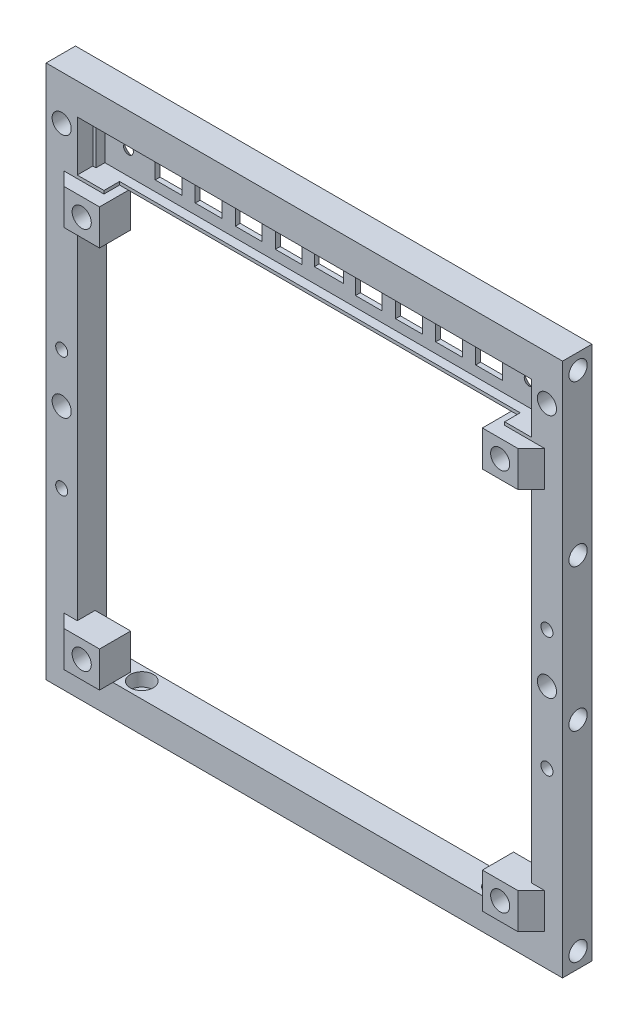
from build123d import *
from build123d.topology import SkipClean

# Parameters (mm, degrees)
SKETCH1_W                = 116
SKETCH1_H                = 120
SKETCH1_W_2              = 102
SKETCH1_H_2              = 106
BOSS_EXTRUDE1_DEPTH      = 7
SKETCH2_R                = 2.05
CUT_EXTRUDE1_DEPTH       = 6
SKETCH3_R                = 1.35
CUT_EXTRUDE2_DEPTH       = 128.208490283
SKETCH4_R                = 2.6
CUT_EXTRUDE3_DEPTH       = 3
SKETCH5_R                = 1.35
CUT_EXTRUDE4_DEPTH       = 84.743656476
SKETCH6_R                = 2.5
CUT_EXTRUDE5_DEPTH       = 3
SKETCH7_R                = 2.15
CUT_EXTRUDE6_DEPTH       = 84.743656476
CUT_EXTRUDE7_DEPTH       = 0.2
SKETCH9_W                = 2.7
SKETCH9_H                = 2.7
CUT_EXTRUDE8_DEPTH       = 0.2
SKETCH10_W               = 6
SKETCH10_H               = 6
BOSS_EXTRUDE2_DEPTH      = 5.5
SKETCH11_R               = 1.65
CUT_EXTRUDE9_DEPTH       = 84.631632771
SKETCH12_W               = 102
SKETCH12_H               = 12
BOSS_EXTRUDE3_DEPTH      = 1.5
SKETCH13_W               = 102
SKETCH13_H               = 12
SKETCH13_W_2             = 100.6
SKETCH13_H_2             = 10.6
BOSS_EXTRUDE4_DEPTH      = 2
SKETCH14_W               = 6
SKETCH14_H               = 6
SKETCH14_W_2             = 6.5
SKETCH14_H_2             = 4
CUT_EXTRUDE10_DEPTH      = 84.631632771
SKETCH15_R               = 1
BOSS_EXTRUDE5_DEPTH      = 2
CHAMFER1_SIZE            = 0.4
CHAMFER2_SIZE            = 0.4
CHAMFER3_SIZE            = 0.4
SKETCH16_W               = 6
SKETCH16_H               = 6
BOSS_EXTRUDE7_DEPTH      = 5.5
SKETCH17_R               = 1.65
CUT_EXTRUDE11_DEPTH      = 84.631632771
CUT_EXTRUDE12_DEPTH      = 84.631632771
CUT_EXTRUDE12_DEPTH_BACK = 84.631632771
SKETCH18_R               = 1.1
CHAMFER4_SIZE            = 1.5
SKETCH19_W               = 102
SKETCH19_H               = 94
CUT_EXTRUDE13_DEPTH      = 84.631632771
SKETCH20_W               = 8
SKETCH20_H               = 8
BOSS_EXTRUDE8_DEPTH      = 7
CHAMFER5_SIZE            = 3
SKETCH21_R               = 2.15
CUT_EXTRUDE14_DEPTH      = 84.743656476
CHAMFER6_SIZE            = 0.4
CHAMFER7_SIZE            = 0.4


# Some blends are built 0.0001 mm under size
with BuildPart() as part:
    # Sketch1 → Boss-Extrude1 (new body)
    with BuildSketch(Plane.XY):
        Rectangle(SKETCH1_W, SKETCH1_H)
        Rectangle(SKETCH1_W_2, SKETCH1_H_2, mode=Mode.SUBTRACT)
    extrude(amount=BOSS_EXTRUDE1_DEPTH)

    # Sketch2 → Cut-Extrude1 (cut)
    with BuildSketch(Plane.ZY.offset(58)):
        with Locations((3.5, -56.5)):
            Circle(SKETCH2_R)
        with Locations((3.5, 56.5)):
            Circle(SKETCH2_R)
        with Locations((3.5, 20.5)):
            Circle(SKETCH2_R)
        with Locations((3.5, -11.5)):
            Circle(SKETCH2_R)
    cut_extrude1 = extrude(amount=-CUT_EXTRUDE1_DEPTH, mode=Mode.SUBTRACT)

    # Mirror1: Cut-Extrude1 across plane
    add(cut_extrude1.mirror(Plane(origin=(0, 0, 0), x_dir=(0, 0, 1), z_dir=(1, 0, 0))), mode=Mode.SUBTRACT)

    # Sketch3 → Cut-Extrude2 (cut, through all)
    with BuildSketch(Plane(origin=(0, -53, 0), x_dir=(1, 0, 0), z_dir=(0, 1, 0))):
        with Locations(Location((40, -3.5, 0), (0, 0, 270))):
            Circle(SKETCH3_R)
        with Locations(Location((-40, -3.5, 0), (0, 0, 270))):
            Circle(SKETCH3_R)
    extrude(amount=-CUT_EXTRUDE2_DEPTH, mode=Mode.SUBTRACT)

    # Sketch4 → Cut-Extrude3 (cut)
    with BuildSketch(Plane(origin=(0, -53, 0), x_dir=(1, 0, 0), z_dir=(0, 1, 0))):
        with Locations(Location((40, -3.5, 0), (0, 0, 270))):
            Circle(SKETCH4_R)
        with Locations(Location((-40, -3.5, 0), (0, 0, 270))):
            Circle(SKETCH4_R)
    extrude(amount=-CUT_EXTRUDE3_DEPTH, mode=Mode.SUBTRACT)

    # Sketch5 → Cut-Extrude4 (cut, through all)
    with BuildSketch(Plane(origin=(0, 0, 0), x_dir=(-1, 0, 0), z_dir=(0, 0, -1))):
        with Locations((-54.5, 6)):
            Circle(SKETCH5_R)
        with Locations(Location((54.5, 6, 0), (0, 0, 180))):
            Circle(SKETCH5_R)
        with Locations((-54.5, -21)):
            Circle(SKETCH5_R)
        with Locations(Location((54.5, -21, 0), (0, 0, 180))):
            Circle(SKETCH5_R)
    extrude(amount=-CUT_EXTRUDE4_DEPTH, mode=Mode.SUBTRACT)

    # Sketch6 → Cut-Extrude5 (cut)
    with BuildSketch(Plane(origin=(0, 0, 0), x_dir=(-1, 0, 0), z_dir=(0, 0, -1))):
        with Locations((-54.5, 6)):
            Circle(SKETCH6_R)
        with Locations((54.5, 6)):
            Circle(SKETCH6_R)
        with Locations((-54.5, -21)):
            Circle(SKETCH6_R)
        with Locations((54.5, -21)):
            Circle(SKETCH6_R)
    extrude(amount=-CUT_EXTRUDE5_DEPTH, mode=Mode.SUBTRACT)

    # Sketch7 → Cut-Extrude6 (cut, through all)
    with BuildSketch(Plane(origin=(0, 0, 0), x_dir=(-1, 0, 0), z_dir=(0, 0, -1))):
        with Locations((-54.5, 50)):
            Circle(SKETCH7_R)
        with Locations((-54.5, -5)):
            Circle(SKETCH7_R)
    cut_extrude6 = extrude(amount=-CUT_EXTRUDE6_DEPTH, mode=Mode.SUBTRACT)

    # Mirror2: Cut-Extrude6 across plane
    add(cut_extrude6.mirror(Plane(origin=(0, 0, 0), x_dir=(0, 0, 1), z_dir=(1, 0, 0))), mode=Mode.SUBTRACT)

    # Sketch8 → Cut-Extrude7 (cut)
    with SkipClean():  # the faces are left unmerged after this step: merging them gives an invalid solid
        with BuildSketch(Plane(origin=(0, 0, 3), x_dir=(-1, 0, 0), z_dir=(0, 0, -1))):
            with BuildLine():
                Line((-55.85, 3.895837459), (-55.85, 8.104162541))
                ThreePointArc((-55.85, 8.104162541), (-54.5, 8.5), (-53.15, 8.104162541))
                Line((-53.15, 8.104162541), (-53.15, 3.895837459))
                ThreePointArc((-53.15, 3.895837459), (-54.5, 3.5), (-55.85, 3.895837459))
            make_face()
            with BuildLine():
                Line((-55.85, -23.104162541), (-55.85, -18.895837459))
                ThreePointArc((-55.85, -18.895837459), (-54.5, -18.5), (-53.15, -18.895837459))
                Line((-53.15, -18.895837459), (-53.15, -23.104162541))
                ThreePointArc((-53.15, -23.104162541), (-54.5, -23.5), (-55.85, -23.104162541))
            make_face()
        cut_extrude7 = extrude(amount=-CUT_EXTRUDE7_DEPTH, mode=Mode.SUBTRACT)

    # Sketch9 → Cut-Extrude8 (cut)
    with SkipClean():  # the faces are left unmerged after this step: merging them gives an invalid solid
        with BuildSketch(Plane(origin=(0, 0, 3.2), x_dir=(-1, 0, 0), z_dir=(0, 0, -1))):
            with Locations((-54.5, 6)):
                Rectangle(SKETCH9_W, SKETCH9_H)
            with Locations((-54.5, -21)):
                Rectangle(SKETCH9_W, SKETCH9_H)
        cut_extrude8 = extrude(amount=-CUT_EXTRUDE8_DEPTH, mode=Mode.SUBTRACT)

    # Mirror3: Cut-Extrude7, Cut-Extrude8 across plane
    with SkipClean():  # the faces are left unmerged after this step: merging them gives an invalid solid
        add(cut_extrude7.mirror(Plane(origin=(0, 0, 0), x_dir=(0, 0, 1), z_dir=(1, 0, 0))), mode=Mode.SUBTRACT)
        add(cut_extrude8.mirror(Plane(origin=(0, 0, 0), x_dir=(0, 0, 1), z_dir=(1, 0, 0))), mode=Mode.SUBTRACT)

    # Sketch10 → Boss-Extrude2 (add)
    with SkipClean():  # the faces are left unmerged after this step: merging them gives an invalid solid
        with BuildSketch(Plane.XY.offset(7)):
            with Locations((48, -50)):
                Rectangle(SKETCH10_W, SKETCH10_H)
            with Locations((48, -20.5)):
                Rectangle(SKETCH10_W, SKETCH10_H)
        boss_extrude2 = extrude(amount=-BOSS_EXTRUDE2_DEPTH)

    # Sketch11 → Cut-Extrude9 (cut, through all)
    with SkipClean():  # the faces are left unmerged after this step: merging them gives an invalid solid
        with BuildSketch(Plane(origin=(0, 0, 1.5), x_dir=(-1, 0, 0), z_dir=(0, 0, -1))):
            with Locations((-48, -20.5)):
                Circle(SKETCH11_R)
            with Locations((-48, -50)):
                Circle(SKETCH11_R)
        cut_extrude9 = extrude(amount=-CUT_EXTRUDE9_DEPTH, mode=Mode.SUBTRACT)

    # Mirror4: Boss-Extrude2, Cut-Extrude9 across plane
    with SkipClean():  # the faces are left unmerged after this step: merging them gives an invalid solid
        add(boss_extrude2.mirror(Plane(origin=(0, 0, 0), x_dir=(0, 0, 1), z_dir=(1, 0, 0))))
        add(cut_extrude9.mirror(Plane(origin=(0, 0, 0), x_dir=(0, 0, 1), z_dir=(1, 0, 0))), mode=Mode.SUBTRACT)

    # Sketch12 → Boss-Extrude3 (add)
    with SkipClean():  # the faces are left unmerged after this step: merging them gives an invalid solid
        with BuildSketch(Plane(origin=(0, 0, 0), x_dir=(-1, 0, 0), z_dir=(0, 0, -1))):
            with Locations((0, 47)):
                Rectangle(SKETCH12_W, SKETCH12_H)
        extrude(amount=-BOSS_EXTRUDE3_DEPTH)

    # Sketch13 → Boss-Extrude4 (add)
    with SkipClean():  # the faces are left unmerged after this step: merging them gives an invalid solid
        with BuildSketch(Plane.XY.offset(1.5)):
            with Locations((0, 47)):
                Rectangle(SKETCH13_W, SKETCH13_H)
            with Locations((0, 47)):
                Rectangle(SKETCH13_W_2, SKETCH13_H_2, mode=Mode.SUBTRACT)
        extrude(amount=BOSS_EXTRUDE4_DEPTH)

    # Sketch14 → Cut-Extrude10 (cut, through all)
    with SkipClean():  # the faces are left unmerged after this step: merging them gives an invalid solid
        with BuildSketch(Plane.XY.offset(1.5)):
            with Locations((-36, 47)):
                Rectangle(SKETCH14_W, SKETCH14_H)
            with Locations((0, 47)):
                Rectangle(SKETCH14_W_2, SKETCH14_H_2)
            with Locations((9, 47)):
                Rectangle(SKETCH14_W, SKETCH14_H)
            with Locations((18, 47)):
                Rectangle(SKETCH14_W, SKETCH14_H)
            with Locations((27, 47)):
                Rectangle(SKETCH14_W, SKETCH14_H)
            with Locations((36, 47)):
                Rectangle(SKETCH14_W, SKETCH14_H)
            with Locations((-27, 47)):
                Rectangle(SKETCH14_W, SKETCH14_H)
            with Locations((-18, 47)):
                Rectangle(SKETCH14_W, SKETCH14_H)
            with Locations((-9, 47)):
                Rectangle(SKETCH14_W, SKETCH14_H)
        extrude(amount=-CUT_EXTRUDE10_DEPTH, mode=Mode.SUBTRACT)

    # Sketch15 → Boss-Extrude5 (add)
    with SkipClean():  # the faces are left unmerged after this step: merging them gives an invalid solid
        with BuildSketch(Plane.XY.offset(1.5)):
            with Locations(Location((-45, 47, 0), (0, 0, 180))):
                Circle(SKETCH15_R)
            with Locations(Location((45, 47, 0), (0, 0, 180))):
                Circle(SKETCH15_R)
        extrude(amount=BOSS_EXTRUDE5_DEPTH)

    # Chamfer1
    # the kernel refuses this chamfer: 0.4 mm, written as the material it takes off along each edge
    with BuildSketch(Plane(origin=(51, -53, 0), x_dir=(0.9996219169112968, 0, -0.02749587661058673), z_dir=(0, 1, 0)), Plane(origin=(-51, 41, 0), x_dir=(-0.9996219169112968, 0, -0.02749587661058673), z_dir=(0, -1, 0))) as chamfer1_piece_1:
        Polygon((CHAMFER1_SIZE * 0.999621916911, -CHAMFER1_SIZE * 0.0274958766106), (-CHAMFER1_SIZE * 0.0274958766106, -CHAMFER1_SIZE * 0.999621916911), (0, 0), align=None)
    extrude(amount=94, mode=Mode.SUBTRACT)
    with BuildSketch(Plane(origin=(-51, -53, 0), x_dir=(0, -0.9996219169112968, -0.02749587661058673), z_dir=(1, 0, 0))) as chamfer1_piece_2:
        Polygon((CHAMFER1_SIZE * 0.999621916911, -CHAMFER1_SIZE * 0.0274958766106), (-CHAMFER1_SIZE * 0.0274958766106, -CHAMFER1_SIZE * 0.999621916911), (0, 0), align=None)
    extrude(amount=102, mode=Mode.SUBTRACT)
    with BuildSketch(Plane(origin=(-51, 41, 0), x_dir=(0, 0.9996219169112968, -0.02749587661058673), z_dir=(1, 0, 0))) as chamfer1_piece_3:
        Polygon((CHAMFER1_SIZE * 0.999621916911, CHAMFER1_SIZE * 0.0274958766106), (-CHAMFER1_SIZE * 0.0274958766106, CHAMFER1_SIZE * 0.999621916911), (0, 0), align=None)
    extrude(amount=102, mode=Mode.SUBTRACT)
    with BuildSketch(Plane(origin=(-51, -53, 0), x_dir=(0, -0.9996219169112968, -0.02749587661058673), z_dir=(1, 0, 0))) as chamfer1_piece_4a_section:
        Polygon((CHAMFER1_SIZE * 0.999621916911, -CHAMFER1_SIZE * 0.0274958766106), (-CHAMFER1_SIZE * 0.0274958766106, -CHAMFER1_SIZE * 0.999621916911), (0, 0), align=None)
    chamfer1_piece_4a = extrude(amount=103.028673195, mode=Mode.PRIVATE)
    chamfer1_piece_4a = split(chamfer1_piece_4a, bisect_by=Plane(origin=(51, -53.131917451, 0.131917451), z_dir=(1, 0, 0)), keep=Keep.TOP, mode=Mode.PRIVATE)
    with BuildSketch(Plane(origin=(51, -54.028673195, 0), x_dir=(0.9996219169112968, 0, -0.02749587661058673), z_dir=(0, 1, 0))) as chamfer1_piece_4b_section:
        Polygon((CHAMFER1_SIZE * 0.999621916911, -CHAMFER1_SIZE * 0.0274958766106), (-CHAMFER1_SIZE * 0.0274958766106, -CHAMFER1_SIZE * 0.999621916911), (0, 0), align=None)
    chamfer1_piece_4b = extrude(amount=95.028673195, mode=Mode.PRIVATE)
    chamfer1_piece_4b = split(chamfer1_piece_4b, bisect_by=Plane(origin=(51.131917451, -53, 0.131917451), z_dir=(0, -1, 0)), keep=Keep.TOP, mode=Mode.PRIVATE)
    chamfer1_piece_4 = chamfer1_piece_4a & chamfer1_piece_4b
    add(chamfer1_piece_4, mode=Mode.SUBTRACT)
    with BuildSketch(Plane(origin=(51, -53, 0), x_dir=(0.9996219169112968, 0, -0.02749587661058673), z_dir=(0, 1, 0))) as chamfer1_piece_5a_section:
        Polygon((CHAMFER1_SIZE * 0.999621916911, -CHAMFER1_SIZE * 0.0274958766106), (-CHAMFER1_SIZE * 0.0274958766106, -CHAMFER1_SIZE * 0.999621916911), (0, 0), align=None)
    chamfer1_piece_5a = extrude(amount=95.028673195, mode=Mode.PRIVATE)
    chamfer1_piece_5a = split(chamfer1_piece_5a, bisect_by=Plane(origin=(51.131917451, 41, 0.131917451), z_dir=(0, 1, 0)), keep=Keep.TOP, mode=Mode.PRIVATE)
    with BuildSketch(Plane(origin=(-51, 41, 0), x_dir=(0, 0.9996219169112968, -0.02749587661058673), z_dir=(1, 0, 0))) as chamfer1_piece_5b_section:
        Polygon((CHAMFER1_SIZE * 0.999621916911, CHAMFER1_SIZE * 0.0274958766106), (-CHAMFER1_SIZE * 0.0274958766106, CHAMFER1_SIZE * 0.999621916911), (0, 0), align=None)
    chamfer1_piece_5b = extrude(amount=103.028673195, mode=Mode.PRIVATE)
    chamfer1_piece_5b = split(chamfer1_piece_5b, bisect_by=Plane(origin=(51, 41.131917451, 0.131917451), z_dir=(1, 0, 0)), keep=Keep.TOP, mode=Mode.PRIVATE)
    chamfer1_piece_5 = chamfer1_piece_5a & chamfer1_piece_5b
    add(chamfer1_piece_5, mode=Mode.SUBTRACT)
    with BuildSketch(Plane(origin=(-51, 41, 0), x_dir=(-0.9996219169112968, 0, -0.02749587661058673), z_dir=(0, -1, 0))) as chamfer1_piece_6a_section:
        Polygon((CHAMFER1_SIZE * 0.999621916911, -CHAMFER1_SIZE * 0.0274958766106), (-CHAMFER1_SIZE * 0.0274958766106, -CHAMFER1_SIZE * 0.999621916911), (0, 0), align=None)
    chamfer1_piece_6a = extrude(amount=95.028673195, mode=Mode.PRIVATE)
    chamfer1_piece_6a = split(chamfer1_piece_6a, bisect_by=Plane(origin=(-51.131917451, -53, 0.131917451), z_dir=(0, -1, 0)), keep=Keep.TOP, mode=Mode.PRIVATE)
    with BuildSketch(Plane(origin=(-52.028673195, -53, 0), x_dir=(0, -0.9996219169112968, -0.02749587661058673), z_dir=(1, 0, 0))) as chamfer1_piece_6b_section:
        Polygon((CHAMFER1_SIZE * 0.999621916911, -CHAMFER1_SIZE * 0.0274958766106), (-CHAMFER1_SIZE * 0.0274958766106, -CHAMFER1_SIZE * 0.999621916911), (0, 0), align=None)
    chamfer1_piece_6b = extrude(amount=103.028673195, mode=Mode.PRIVATE)
    chamfer1_piece_6b = split(chamfer1_piece_6b, bisect_by=Plane(origin=(-51, -53.131917451, 0.131917451), z_dir=(-1, 0, 0)), keep=Keep.TOP, mode=Mode.PRIVATE)
    chamfer1_piece_6 = chamfer1_piece_6a & chamfer1_piece_6b
    add(chamfer1_piece_6, mode=Mode.SUBTRACT)
    with BuildSketch(Plane(origin=(-51, 42.028673195, 0), x_dir=(-0.9996219169112968, 0, -0.02749587661058673), z_dir=(0, -1, 0))) as chamfer1_piece_7a_section:
        Polygon((CHAMFER1_SIZE * 0.999621916911, -CHAMFER1_SIZE * 0.0274958766106), (-CHAMFER1_SIZE * 0.0274958766106, -CHAMFER1_SIZE * 0.999621916911), (0, 0), align=None)
    chamfer1_piece_7a = extrude(amount=95.028673195, mode=Mode.PRIVATE)
    chamfer1_piece_7a = split(chamfer1_piece_7a, bisect_by=Plane(origin=(-51.131917451, 41, 0.131917451), z_dir=(0, 1, 0)), keep=Keep.TOP, mode=Mode.PRIVATE)
    with BuildSketch(Plane(origin=(-52.028673195, 41, 0), x_dir=(0, 0.9996219169112968, -0.02749587661058673), z_dir=(1, 0, 0))) as chamfer1_piece_7b_section:
        Polygon((CHAMFER1_SIZE * 0.999621916911, CHAMFER1_SIZE * 0.0274958766106), (-CHAMFER1_SIZE * 0.0274958766106, CHAMFER1_SIZE * 0.999621916911), (0, 0), align=None)
    chamfer1_piece_7b = extrude(amount=103.028673195, mode=Mode.PRIVATE)
    chamfer1_piece_7b = split(chamfer1_piece_7b, bisect_by=Plane(origin=(-51, 41.131917451, 0.131917451), z_dir=(-1, 0, 0)), keep=Keep.TOP, mode=Mode.PRIVATE)
    chamfer1_piece_7 = chamfer1_piece_7a & chamfer1_piece_7b
    add(chamfer1_piece_7, mode=Mode.SUBTRACT)

    # Chamfer2
    chamfer2_edges = [part.edges().sort_by_distance(p)[0] for p in [
        (0, -60, 0),
        (-58, 0, 0),
        (0, 60, 0),
        (58, 0, 0),
    ]]
    chamfer(chamfer2_edges, length=CHAMFER2_SIZE)

    # Chamfer3
    chamfer3_edges = [part.edges().sort_by_distance(p)[0] for p in [
        (-6, 47, 0),
        (-9, 44, 0),
        (-12, 47, 0),
        (-9, 50, 0),
        (-15, 47, 0),
        (-18, 44, 0),
        (-21, 47, 0),
        (-18, 50, 0),
        (-24, 47, 0),
        (-27, 44, 0),
        (-30, 47, 0),
        (-27, 50, 0),
        (-33, 47, 0),
        (-36, 44, 0),
        (-39, 47, 0),
        (-36, 50, 0),
        (39, 47, 0),
        (36, 44, 0),
        (33, 47, 0),
        (36, 50, 0),
        (30, 47, 0),
        (27, 44, 0),
        (24, 47, 0),
        (27, 50, 0),
        (21, 47, 0),
        (18, 44, 0),
        (15, 47, 0),
        (18, 50, 0),
        (12, 47, 0),
        (9, 44, 0),
        (6, 47, 0),
        (9, 50, 0),
        (3.25, 47, 0),
        (0, 45, 0),
        (-3.25, 47, 0),
        (0, 49, 0),
    ]]
    chamfer(chamfer3_edges, length=CHAMFER3_SIZE)

    # Sketch16 → Boss-Extrude7 (add)
    with BuildSketch(Plane.XY.offset(7)):
        Polygon((-45, 41), (-45, 41.7), (-51, 41.7), (-51, 41), (-51, 35), (-45, 35), align=None)
        with Locations((-48, -14.5)):
            Rectangle(SKETCH16_W, SKETCH16_H)
        with Locations((48, -14.5)):
            Rectangle(SKETCH16_W, SKETCH16_H)
        Polygon((51, 41), (51, 35), (45, 35), (45, 41), (45, 41.7), (51, 41.7), align=None)
    extrude(amount=-BOSS_EXTRUDE7_DEPTH)

    # Sketch17 → Cut-Extrude11 (cut, through all)
    with BuildSketch(Plane(origin=(0, 0, 1.5), x_dir=(-1, 0, 0), z_dir=(0, 0, -1))):
        with Locations((-48, -14.5)):
            Circle(SKETCH17_R)
        with Locations((48, -14.5)):
            Circle(SKETCH17_R)
        with Locations((48, 38)):
            Circle(SKETCH17_R)
        with Locations((-48, 38)):
            Circle(SKETCH17_R)
    extrude(amount=-CUT_EXTRUDE11_DEPTH, mode=Mode.SUBTRACT)

    # Sketch18 → Cut-Extrude12 (cut, two sides: drawn at the far end of the back side and taken through both)
    with BuildSketch(Plane.XY.offset(1.5).offset(-CUT_EXTRUDE12_DEPTH_BACK)):
        with Locations((-45, 47)):
            Circle(SKETCH18_R)
        with Locations((45, 47)):
            Circle(SKETCH18_R)
    extrude(amount=CUT_EXTRUDE12_DEPTH + CUT_EXTRUDE12_DEPTH_BACK, mode=Mode.SUBTRACT)

    # Chamfer4
    chamfer4_edges = [part.edges().sort_by_distance(p)[0] for p in [
        (-46.1, 47, 0),
        (43.9, 47, 0),
    ]]
    chamfer(chamfer4_edges, length=CHAMFER4_SIZE - 0.0001)  # a hair under: the kernel refuses the full size

    # Sketch19 → Cut-Extrude13 (cut, through all)
    with BuildSketch(Plane(origin=(0, 0, 1.5), x_dir=(-1, 0, 0), z_dir=(0, 0, -1))):
        with Locations((0, -6)):
            Rectangle(SKETCH19_W, SKETCH19_H)
    extrude(amount=-CUT_EXTRUDE13_DEPTH, mode=Mode.SUBTRACT)

    # Sketch20 → Boss-Extrude8 (add)
    with BuildSketch(Plane(origin=(0, 0, 3), x_dir=(-1, 0, 0), z_dir=(0, 0, -1))):
        with Locations((-47, 37)):
            Rectangle(SKETCH20_W, SKETCH20_H)
        with Locations((-47, -49)):
            Rectangle(SKETCH20_W, SKETCH20_H)
        with Locations((47, -49)):
            Rectangle(SKETCH20_W, SKETCH20_H)
        with Locations((47, 37)):
            Rectangle(SKETCH20_W, SKETCH20_H)
    extrude(amount=-BOSS_EXTRUDE8_DEPTH)

    # Chamfer5
    # the kernel refuses this chamfer: 3 mm, written as the material it adds along each edge
    with BuildSketch(Plane(origin=(51, 41, 7), x_dir=(-0.02749587661058678, 0, 0.9996219169112968), z_dir=(0, -1, 0)), Plane(origin=(51, -45, 7), x_dir=(-0.02749587661058908, 0, 0.9996219169112965), z_dir=(0, -1, 0)), Plane(origin=(-51, -53, 7), x_dir=(0.02749587661058908, 0, 0.9996219169112965), z_dir=(0, 1, 0)), Plane(origin=(-51, 33, 7), x_dir=(0.027495876610584485, 0, 0.9996219169112969), z_dir=(0, 1, 0))) as chamfer5_piece_1:
        Polygon((CHAMFER5_SIZE * 0.999621916911, -CHAMFER5_SIZE * 0.0274958766106), (-CHAMFER5_SIZE * 0.0274958766106, -CHAMFER5_SIZE * 0.999621916911), (0, 0), align=None)
    extrude(amount=8)

    # Sketch21 → Cut-Extrude14 (cut, through all)
    with BuildSketch(Plane(origin=(0, 0, 3), x_dir=(-1, 0, 0), z_dir=(0, 0, -1))):
        with Locations((-47, 37)):
            Circle(SKETCH21_R)
        with Locations((-47, -49)):
            Circle(SKETCH21_R)
        with Locations(Location((47, -49, 0), (0, 0, 180))):
            Circle(SKETCH21_R)
        with Locations(Location((47, 37, 0), (0, 0, 180))):
            Circle(SKETCH21_R)
    extrude(amount=-CUT_EXTRUDE14_DEPTH, mode=Mode.SUBTRACT)

    # Chamfer6
    chamfer6_edges = [part.edges().sort_by_distance(p)[0] for p in [
        (-49.15, 37, 3),
        (-49.15, -49, 3),
        (49.15, -49, 3),
        (49.15, 37, 3),
    ]]
    chamfer(chamfer6_edges, length=CHAMFER6_SIZE)

    # Chamfer7
    chamfer7_edges = [part.edges().sort_by_distance(p)[0] for p in [
        (56.65, -5, 0),
        (56.65, 50, 0),
        (-56.65, -5, 0),
        (-56.65, 50, 0),
    ]]
    chamfer(chamfer7_edges, length=CHAMFER7_SIZE)


solid = part.part
